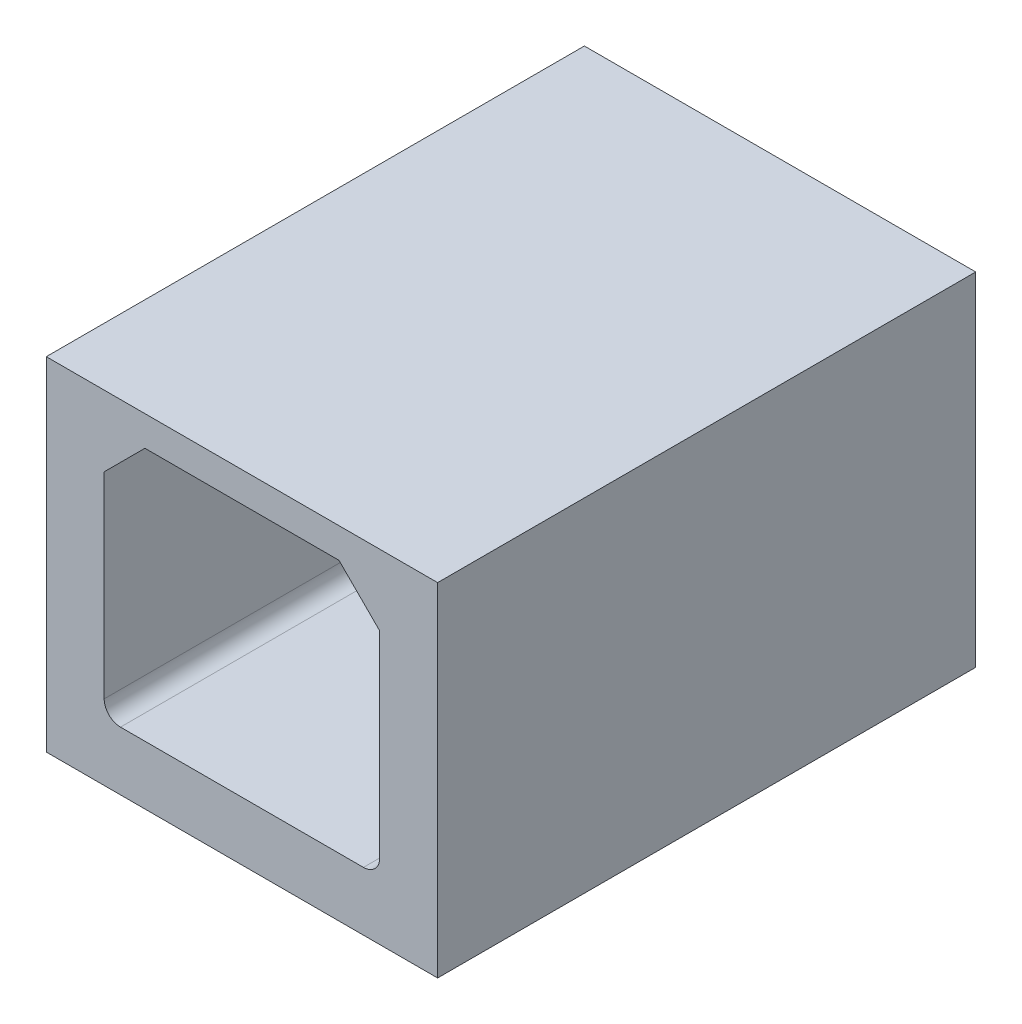
from build123d import *

# Parameters (mm, degrees)
SKETCH1_W             = 12
SKETCH1_H             = 10.5
BASE_DEPTH            = 8.25
CONTACT_OPENING_DEPTH = 9


with BuildPart() as part:
    # Sketch1 → Base (new, symmetric)
    with BuildSketch(Plane.XY):
        Rectangle(SKETCH1_W, SKETCH1_H)
    extrude(amount=BASE_DEPTH, both=True)

    # Sketch2 → Contact Opening (cut)
    with BuildSketch(Plane.XY.offset(8.25)):
        with BuildLine():
            Line((-2.975, 4.33), (-4.225, 3.08))
            Line((-4.225, 3.08), (-4.225, -2.95))
            ThreePointArc((-4.225, -2.95), (-4.078553391, -3.303553391), (-3.725, -3.45))
            Line((-3.725, -3.45), (3.725, -3.45))
            ThreePointArc((3.725, -3.45), (4.078553391, -3.303553391), (4.225, -2.95))
            Line((4.225, -2.95), (4.225, 3.08))
            Line((4.225, 3.08), (2.975, 4.33))
            Line((2.975, 4.33), (-2.975, 4.33))
        make_face()
    extrude(amount=-CONTACT_OPENING_DEPTH, mode=Mode.SUBTRACT)


solid = part.part
